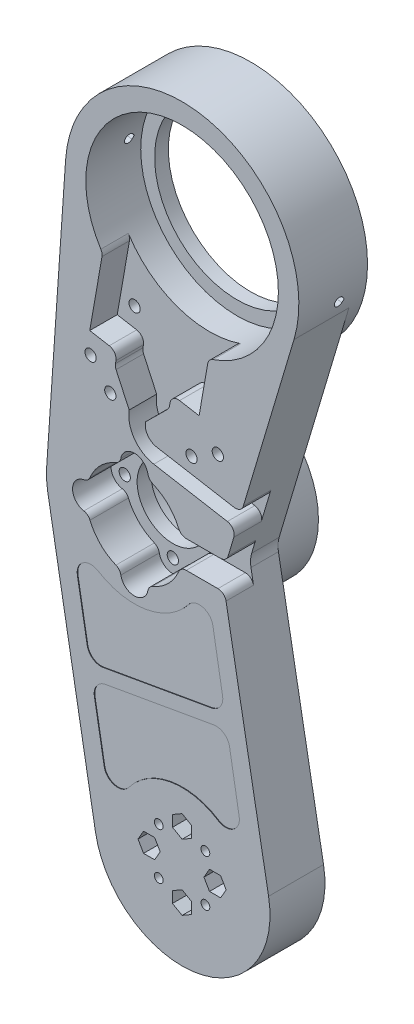
from build123d import *

# Parameters (mm, degrees)
MAIN_R                   = 32
MAIN_R_2                 = 25
MAIN_R_3                 = 16.25
MAIN_R_4                 = 2.05
MAIN_R_5                 = 35.05
BOSS_EXTRUDE10_DEPTH     = 20
BOSS_EXTRUDE11_START     = 6
MAIN_18_R                = 25
BOSS_EXTRUDE11_DEPTH     = 14
BOSS_EXTRUDE12_START     = 1
MAIN_19_R                = 25
MAIN_19_R_2              = 2.05
MAIN_19_R_3              = 13
BOSS_EXTRUDE12_DEPTH     = 5
BOSS_EXTRUDE13_START     = -15
MAIN_20_R                = 32
MAIN_20_R_2              = 25
BOSS_EXTRUDE13_DEPTH     = 15
BOSS_EXTRUDE14_START     = -5
MAIN_21_R                = 42.5
MAIN_21_R_2              = 35.05
MAIN_21_R_3              = 30
BOSS_EXTRUDE14_DEPTH     = 5
MAIN_24_R                = 16.25
CUT_EXTRUDE1_DEPTH       = 3.5
SKETCH1_R                = 2.05
SKETCH1_R_2              = 1.6
CUT_EXTRUDE2_DEPTH       = 7
CUT_EXTRUDE3_START       = -7
SKETCH1_4_R              = 1.6
CUT_EXTRUDE3_DEPTH       = 13
CUT_EXTRUDE4_START       = -10
CUT_EXTRUDE4_DEPTH       = 10
CUT_EXTRUDE5_START       = -10
SKETCH2_12_R             = 2.05
CUT_EXTRUDE5_DEPTH       = 7
CUT_EXTRUDE6_START       = -17
SKETCH2_13_R             = 1.6
CUT_EXTRUDE6_DEPTH       = 7
BOSS_EXTRUDE15_DEPTH     = 10
INTERSECT1_START         = 10
INTERSECT1_DEPTH         = 10
FILLET1_R                = 3
CUT_EXTRUDE8_DEPTH       = 10
FILLET3_R                = 3
FILLET4_R                = 3.25
CUT_EXTRUDE10_DEPTH      = 13
CUT_EXTRUDE11_REACH      = 248.187
SKETCH6_R                = 1.6
SKETCH6_3_R              = 1.6
CUT_EXTRUDE12_DEPTH      = 3.5
SKETCH4_R                = 2.05
CUT_EXTRUDE13_DEPTH      = 7
CUT_EXTRUDE14_START      = -7
SKETCH4_3_R              = 1.6
CUT_EXTRUDE14_DEPTH      = 13
FILLET5_R                = 10
CUT_EXTRUDE15_START      = -12.6
CUT_EXTRUDE15_DEPTH      = 12.6
CUT_EXTRUDE16_DEPTH      = 256.538758289
CUT_EXTRUDE16_DEPTH_BACK = 256.538758289
CUT_EXTRUDE17_START      = -0.2
CUT_EXTRUDE17_DEPTH      = 0.2


# Read off the part's stored shape, not the designer's step: Intersect1
with BuildPart() as part:
    # Main → Boss-Extrude10 (new body)
    # profile 1 of 6: a face of its own
    with BuildSketch(Plane(origin=(0, 0, 0), x_dir=(0, 1, 0), z_dir=(0, 0, 1))):
        with Locations((98.480775301, 17.364817767)):
            Circle(MAIN_R)
        with Locations(Location((98.480775301, 17.364817767, 0), (0, 0, 270))):
            Circle(MAIN_R_2, mode=Mode.SUBTRACT)
    # profile 2 of 6: a face of its own
    with BuildSketch(Plane(origin=(0, 0, 0), x_dir=(0, 1, 0), z_dir=(0, 0, 1))):
        with BuildLine():
            Line((92.924033616, 48.878665863), (-5.556741685, 31.513848096))
            ThreePointArc((-5.556741685, 31.513848096), (20.56920351, 24.51342218), (32, 0))
            ThreePointArc((32, 0), (24.566327125, -20.505988676), (5.719026775, -31.484801615))
            Line((5.719026775, -31.484801615), (98.480775301, -14.635182233))
            ThreePointArc((98.480775301, -14.635182233), (66.602544962, 14.575833999), (92.924033616, 48.878665863))
        make_face()
    # profile 3 of 6: a face of its own
    with BuildSketch(Plane(origin=(0, 0, 0), x_dir=(0, 1, 0), z_dir=(0, 0, 1))):
        Circle(MAIN_R)
        Circle(MAIN_R_3, mode=Mode.SUBTRACT)
    # profile 4 of 6: a face of its own
    with BuildSketch(Plane(origin=(0, 0, 0), x_dir=(0, 1, 0), z_dir=(0, 0, 1))):
        Circle(MAIN_R_3)
        with Locations(Location((0, 12, 0), (0, 0, 270))):
            Circle(MAIN_R_4, mode=Mode.SUBTRACT)
        with Locations(Location((-12, 0, 0), (0, 0, 270))):
            Circle(MAIN_R_4, mode=Mode.SUBTRACT)
        with Locations(Location((0, -12, 0), (0, 0, 270))):
            Circle(MAIN_R_4, mode=Mode.SUBTRACT)
        with Locations(Location((12, 0, 0), (0, 0, 270))):
            Circle(MAIN_R_4, mode=Mode.SUBTRACT)
    # profile 5 of 6: a face of its own
    with BuildSketch(Plane(origin=(0, 0, 0), x_dir=(0, 1, 0), z_dir=(0, 0, 1))):
        with BuildLine():
            Line((200.891680149, 42.399924481), (100.6754928, 49.289466787))
            ThreePointArc((100.6754928, 49.289466787), (121.871275082, 39.202503542), (130.480775301, 17.364817767))
            ThreePointArc((130.480775301, 17.364817767), (121.108192299, -5.262599231), (98.480775301, -14.635182233))
            Line((98.480775301, -14.635182233), (185.812766687, -40.722055245))
            ThreePointArc((185.812766687, -40.722055245), (156.159327252, 7.58598834), (200.891680149, 42.399924481))
        make_face()
    # profile 6 of 6: a face of its own
    with BuildSketch(Plane(origin=(0, 0, 0), x_dir=(0, 1, 0), z_dir=(0, 0, 1))):
        with BuildLine():
            ThreePointArc((240.476820971, 0), (229.042328492, 29.00317642), (200.891680149, 42.399924481))
            ThreePointArc((200.891680149, 42.399924481), (156.159327252, 7.58598834), (185.812766687, -40.722055245))
            ThreePointArc((185.812766687, -40.722055245), (223.366559971, -34.082417073), (240.476820971, 0))
        make_face()
        with Locations(Location((197.976820971, 0, 0), (0, 0, 270))):
            Circle(MAIN_R_5, mode=Mode.SUBTRACT)
    extrude(amount=BOSS_EXTRUDE10_DEPTH)

    # Main<18> → Boss-Extrude11 (add)
    with BuildSketch(Plane(origin=(0, 0, 0), x_dir=(0, 1, 0), z_dir=(0, 0, 1)).offset(BOSS_EXTRUDE11_START)):
        with Locations(Location((98.480775301, 17.364817767, 0), (0, 0, 270))):
            Circle(MAIN_18_R)
        with BuildLine():
            ThreePointArc((103.429491894, 34.150532052), (110.855143972, 29.739186437), (115.266489587, 22.31353436))
            ThreePointArc((115.266489587, 22.31353436), (120.980775301, 17.364817767), (115.266489587, 12.416101174))
            ThreePointArc((115.266489587, 12.416101174), (110.855143972, 4.990449096), (103.429491894, 0.579103481))
            ThreePointArc((103.429491894, 0.579103481), (98.480775301, -5.135182233), (93.532058708, 0.579103481))
            ThreePointArc((93.532058708, 0.579103481), (86.10640663, 4.990449096), (81.695061016, 12.416101174))
            ThreePointArc((81.695061016, 12.416101174), (75.980775301, 17.364817767), (81.695061016, 22.31353436))
            ThreePointArc((81.695061016, 22.31353436), (86.10640663, 29.739186437), (93.532058708, 34.150532052))
            ThreePointArc((93.532058708, 34.150532052), (98.480775301, 39.864817767), (103.429491894, 34.150532052))
        make_face(mode=Mode.SUBTRACT)
    extrude(amount=BOSS_EXTRUDE11_DEPTH)

    # Main<19> → Boss-Extrude12 (add)
    with BuildSketch(Plane(origin=(0, 0, 0), x_dir=(0, 1, 0), z_dir=(0, 0, 1)).offset(BOSS_EXTRUDE12_START)):
        with Locations(Location((98.480775301, 17.364817767, 0), (0, 0, 270))):
            Circle(MAIN_19_R)
        with Locations(Location((98.480775301, -0.135182233, 0), (0, 0, 270))):
            Circle(MAIN_19_R_2, mode=Mode.SUBTRACT)
        with Locations(Location((80.980775301, 17.364817767, 0), (0, 0, 270))):
            Circle(MAIN_19_R_2, mode=Mode.SUBTRACT)
        with Locations(Location((98.480775301, 17.364817767, 0), (0, 0, 270))):
            Circle(MAIN_19_R_3, mode=Mode.SUBTRACT)
        with Locations(Location((98.480775301, 34.864817767, 0), (0, 0, 270))):
            Circle(MAIN_19_R_2, mode=Mode.SUBTRACT)
        with Locations(Location((115.980775301, 17.364817767, 0), (0, 0, 270))):
            Circle(MAIN_19_R_2, mode=Mode.SUBTRACT)
    extrude(amount=BOSS_EXTRUDE12_DEPTH)

    # Main<20> → Boss-Extrude13 (add)
    with BuildSketch(Plane(origin=(0, 0, 0), x_dir=(0, 1, 0), z_dir=(0, 0, 1)).offset(BOSS_EXTRUDE13_START)):
        with Locations(Location((98.480775301, 17.364817767, 0), (0, 0, 270))):
            Circle(MAIN_20_R)
        with Locations(Location((98.480775301, 17.364817767, 0), (0, 0, 270))):
            Circle(MAIN_20_R_2, mode=Mode.SUBTRACT)
    extrude(amount=BOSS_EXTRUDE13_DEPTH)

    # Main<21> → Boss-Extrude14 (add)
    # profile 1 of 2: a face of its own
    with BuildSketch(Plane(origin=(0, 0, 0), x_dir=(0, 1, 0), z_dir=(0, 0, 1)).offset(BOSS_EXTRUDE14_START)):
        with Locations(Location((197.976820971, 0, 0), (0, 0, 86.067286144))):
            Circle(MAIN_21_R)
        with Locations(Location((197.976820971, 0, 0), (0, 0, 270))):
            Circle(MAIN_21_R_2, mode=Mode.SUBTRACT)
    # profile 2 of 2: a face of its own
    with BuildSketch(Plane(origin=(0, 0, 0), x_dir=(0, 1, 0), z_dir=(0, 0, 1)).offset(BOSS_EXTRUDE14_START)):
        with Locations(Location((197.976820971, 0, 0), (0, 0, 270))):
            Circle(MAIN_21_R_2)
        with Locations(Location((197.976820971, 0, 0), (0, 0, 270))):
            Circle(MAIN_21_R_3, mode=Mode.SUBTRACT)
    extrude(amount=BOSS_EXTRUDE14_DEPTH)

    # Main<24> → Cut-Extrude1 (cut)
    with BuildSketch(Plane(origin=(0, 0, 0), x_dir=(0, 1, 0), z_dir=(0, 0, 1))):
        with Locations(Location((0, 0, 0), (0, 0, 270))):
            Circle(MAIN_24_R)
    extrude(amount=CUT_EXTRUDE1_DEPTH, mode=Mode.SUBTRACT)

    # Sketch1 → Cut-Extrude2 (cut)
    # profile 1 of 4: a face of its own
    with BuildSketch(Plane.XY.offset(20)):
        with Locations((-33.29387447, 143.895697436)):
            Circle(SKETCH1_R)
        with Locations((-33.29387447, 143.895697436)):
            Circle(SKETCH1_R_2, mode=Mode.SUBTRACT)
    # profile 2 of 4: a face of its own
    with BuildSketch(Plane.XY.offset(20)):
        with Locations((-33.29387447, 143.895697436)):
            Circle(SKETCH1_R_2)
    # profile 3 of 4: a face of its own
    with BuildSketch(Plane.XY.offset(20)):
        with Locations((13.006265594, 135.815039664)):
            Circle(SKETCH1_R)
        with Locations((13.006265594, 135.815039664)):
            Circle(SKETCH1_R_2, mode=Mode.SUBTRACT)
    # profile 4 of 4: a face of its own
    with BuildSketch(Plane.XY.offset(20)):
        with Locations((13.006265594, 135.815039664)):
            Circle(SKETCH1_R_2)
    extrude(amount=-CUT_EXTRUDE2_DEPTH, mode=Mode.SUBTRACT)

    # Sketch1<4> → Cut-Extrude3 (cut)
    with BuildSketch(Plane.XY.offset(20).offset(CUT_EXTRUDE3_START)):
        with Locations((-33.29387447, 143.895697436)):
            Circle(SKETCH1_4_R)
        with Locations((13.006265594, 135.815039664)):
            Circle(SKETCH1_4_R)
    extrude(amount=-CUT_EXTRUDE3_DEPTH, mode=Mode.SUBTRACT)

    # Sketch2 → Cut-Extrude4 (cut)
    with BuildSketch(Plane.XY.offset(20).offset(CUT_EXTRUDE4_START)):
        with BuildLine():
            Line((-32.418215797, 158.293450187), (-28.942657764, 178.207525041))
            ThreePointArc((-28.942657764, 178.207525041), (-11.90330288, 165.009960633), (9.636870325, 164.277663262))
            Line((9.636870325, 164.277663262), (7.380202471, 151.34752308))
            Line((7.380202471, 151.34752308), (6.193893138, 144.550268475))
            Line((6.193893138, 144.550268475), (-3.854222365, 146.303943141))
            Line((-3.854222365, 146.303943141), (-23.556409627, 149.742520916))
            Line((-23.556409627, 149.742520916), (-33.60452513, 151.496195582))
            Line((-33.60452513, 151.496195582), (-32.418215797, 158.293450187))
        make_face()
    extrude(amount=CUT_EXTRUDE4_DEPTH, mode=Mode.SUBTRACT)

    # Sketch2<12> → Cut-Extrude5 (cut)
    with BuildSketch(Plane.XY.offset(20).offset(CUT_EXTRUDE5_START)):
        with Locations((-27.295647109, 157.399419965)):
            Circle(SKETCH2_12_R)
        with Locations((2.257633783, 152.241553302)):
            Circle(SKETCH2_12_R)
    extrude(amount=-CUT_EXTRUDE5_DEPTH, mode=Mode.SUBTRACT)

    # Sketch2<13> → Cut-Extrude6 (cut)
    with BuildSketch(Plane.XY.offset(20).offset(CUT_EXTRUDE6_START)):
        with Locations((-27.295647109, 157.399419965)):
            Circle(SKETCH2_13_R)
        with Locations((2.257633783, 152.241553302)):
            Circle(SKETCH2_13_R)
    extrude(amount=-CUT_EXTRUDE6_DEPTH, mode=Mode.SUBTRACT)


with BuildPart() as body_2:
    # Sketch3 → Boss-Extrude15 (new body)
    with BuildSketch(Plane.XY.offset(20)):
        with BuildLine():
            Line((-3.854222365, 146.303943141), (-23.556409627, 149.742520916))
            Line((-23.556409627, 149.742520916), (-24.416054071, 144.816974101))
            Line((-24.416054071, 144.816974101), (-19.262897785, 133.623516702))
            ThreePointArc((-19.262897785, 133.623516702), (-19.251459791, 133.69298479), (-19.239577417, 133.762378249))
            ThreePointArc((-19.239577417, 133.762378249), (-15.839829323, 136.213490782), (-13.307502157, 132.873796353))
            Line((-13.307502157, 132.873796353), (-4.713866809, 141.378396325))
            Line((-4.713866809, 141.378396325), (-3.854222365, 146.303943141))
        make_face()
        with BuildLine():
            ThreePointArc((-19.239577417, 133.762378249), (-19.251459791, 133.69298479), (-19.262897785, 133.623516702))
            ThreePointArc((-19.262897785, 133.623516702), (-17.362353479, 125.488630075), (-10.2945922, 121.034957479))
            ThreePointArc((-10.2945922, 121.034957479), (-6.823477444, 123.474498901), (-9.263018867, 126.945613657))
            ThreePointArc((-9.263018867, 126.945613657), (-12.494122393, 128.996133334), (-13.328921238, 132.730804916))
            ThreePointArc((-13.328921238, 132.730804916), (-13.317350128, 132.802171578), (-13.307502157, 132.873796353))
            ThreePointArc((-13.307502157, 132.873796353), (-15.839829323, 136.213490782), (-19.239577417, 133.762378249))
        make_face()
        with BuildLine():
            ThreePointArc((-9.263018867, 126.945613657), (-6.823477444, 123.474498901), (-10.2945922, 121.034957479))
            Line((-10.2945922, 121.034957479), (19.80323368, 115.782052621))
            Line((19.80323368, 115.782052621), (21.532431998, 121.570953903))
            Line((21.532431998, 121.570953903), (-9.263018867, 126.945613657))
        make_face()
    extrude(amount=-BOSS_EXTRUDE15_DEPTH)


with BuildPart() as intersect1_tool:
    # Intersect1 outline → Intersect1 (new body)
    with BuildSketch(Plane.XY.offset(INTERSECT1_START)):
        with BuildLine():
            Line((-10.2945922, 121.034957479), (19.80323368, 115.782052621))
            Line((19.80323368, 115.782052621), (21.532431998, 121.570953903))
            Line((21.532431998, 121.570953903), (-9.263018867, 126.945613657))
            ThreePointArc((-9.263018867, 126.945613657), (-12.494122393, 128.996133334), (-13.328921238, 132.730804916))
            ThreePointArc((-13.328921238, 132.730804916), (-13.317350128, 132.802171578), (-13.307502157, 132.873796353))
            Line((-13.307502157, 132.873796353), (-4.713866809, 141.378396325))
            Line((-4.713866809, 141.378396325), (-3.854222365, 146.303943141))
            Line((-3.854222365, 146.303943141), (-23.556409627, 149.742520916))
            Line((-23.556409627, 149.742520916), (-24.416054071, 144.816974101))
            Line((-24.416054071, 144.816974101), (-19.262897785, 133.623516702))
            ThreePointArc((-19.262897785, 133.623516702), (-17.362353479, 125.488630075), (-10.2945922, 121.034957479))
        make_face()
    extrude(amount=INTERSECT1_DEPTH)


with BuildPart() as part_1:
    add(part.part)

    # Intersect1: cut by intersect1_tool
    add(intersect1_tool.part, mode=Mode.SUBTRACT)

    # Fillet1
    fillet1_edges = [part_1.edges().sort_by_distance(p)[0] for p in [
        (-28.942657764, 178.207525041, 15),
        (9.636870325, 164.277663262, 15),
        (-3.854222365, 146.303943141, 15),
        (19.80323368, 115.782052621, 15),
        (21.532431998, 121.570953903, 15),
        (-23.556409627, 149.742520916, 15),
        (-24.416054071, 144.816974101, 15),
        (-4.713866809, 141.378396325, 15),
    ]]
    fillet(fillet1_edges, radius=FILLET1_R)

    # Sketch5 → Cut-Extrude8 (cut)
    with BuildSketch(Plane.XY.offset(20)):
        Polygon((16.128728447, 103.480775301), (14.635182233, 98.480775301), (15.543402467, 93.480775301), (-1.864817767, 93.480775301), (-1.864817767, 103.480775301), align=None)
    extrude(amount=-CUT_EXTRUDE8_DEPTH, mode=Mode.SUBTRACT)

    # Fillet3
    # the kernel refuses this fillet: 3 mm, written as the material it takes off along each edge
    with BuildSketch(Plane(origin=(-22.31353436, 115.266489587, 6), x_dir=(0.018092404043592625, 0.999836319062237, 0), z_dir=(0, 0, 1)), Plane(origin=(-12.416101174, 81.695061016, 6), x_dir=(-0.018092404043601622, -0.9998363190622368, 0), z_dir=(0, 0, 1)), Plane(origin=(-34.150532052, 93.532058708, 6), x_dir=(-0.9998363190622366, 0.018092404043610618, 0), z_dir=(0, 0, 1))) as fillet3_piece_1:
        with BuildLine():
            CenterArc((2.089627747, 2.960990062), FILLET3_R, 203.616579082, 57.133535261)
            ThreePointArc((-0.659112793, 1.75914754), (-0.305934486, 0.888424365), (0, 0))
            ThreePointArc((0, 0), (0.803702979, 0.065016563), (1.607405959, 0))
        make_face()
    extrude(amount=18.696427991, mode=Mode.SUBTRACT)
    with BuildSketch(Plane(origin=(-12.416101174, 115.266489587, 6), x_dir=(0.9426230632930053, -0.33385889316912154, 0), z_dir=(0, 0, 1)), Plane(origin=(-22.31353436, 81.695061016, 6), x_dir=(-0.9426230632930039, 0.3338588931691254, 0), z_dir=(0, 0, 1)), Plane(origin=(-34.150532052, 103.429491894, 6), x_dir=(0.33385889316913037, 0.9426230632930022, 0), z_dir=(0, 0, 1))) as fillet3_piece_2:
        with BuildLine():
            CenterArc((2.039591585, 2.995675622), FILLET3_R, 209.789723377, 57.133535261)
            ThreePointArc((-0.563972147, 1.505220693), (-0.221102713, 0.775421964), (0, 0))
            ThreePointArc((0, 0), (0.939285598, 0.025225536), (1.878571196, 0))
        make_face()
    extrude(amount=18.696427991, mode=Mode.SUBTRACT)
    with BuildSketch(Plane(origin=(-0.594307935, 93.480775301, 25.260190642), x_dir=(-0.33850165532610577, -0.9409657960529099, 0), z_dir=(0, 0, -1))) as fillet3_piece_3:
        with BuildLine():
            CenterArc((2.110664092, -2.995368756), FILLET3_R, 93.184063487, 67.030323428)
            Line((-0.712233296, -1.97986379), (0, 0))
            ThreePointArc((0, 0), (0.972016358, -0.02701559), (1.944032717, 0))
        make_face()
    extrude(amount=15.260190642, mode=Mode.SUBTRACT)
    with BuildSketch(Plane(origin=(-0.594307935, 103.480775301, 25.260190642), x_dir=(1, 0, 0), z_dir=(0, 0, -1))) as fillet3_piece_4:
        with BuildLine():
            CenterArc((2.104076257, -3), FILLET3_R, 90, 67.030323428)
            ThreePointArc((-0.658058293, -1.829268293), (-0.3036084, -0.923778968), (0, 0))
            Line((0, 0), (2.104076257, 0))
        make_face()
    extrude(amount=15.260190642, mode=Mode.SUBTRACT)
    with BuildSketch(Plane(origin=(15.543402467, 93.480775301, 26.260395145), x_dir=(-1, 0, 0), z_dir=(0, 0, -1))) as fillet3_piece_5:
        with BuildLine():
            CenterArc((FILLET3_R * 0.834719352725, -FILLET3_R), FILLET3_R, 90, 79.704811763)
            Line((-FILLET3_R * 0.149180697748, -FILLET3_R * 0.821280413277), (0, 0))
            Line((0, 0), (FILLET3_R * 0.834719352725, 0))
        make_face()
    extrude(amount=16.260395145, mode=Mode.SUBTRACT)
    with BuildSketch(Plane(origin=(16.128728447, 103.480775301, 25.587134331), x_dir=(-1, 0, 0), z_dir=(0, 0, -1))) as fillet3_piece_6:
        with BuildLine():
            CenterArc((FILLET3_R * 0.744951244073, FILLET3_R), FILLET3_R, 196.63137158, 73.36862842)
            Line((-FILLET3_R * 0.213214761691, FILLET3_R * 0.713786958023), (0, 0))
            Line((0, 0), (FILLET3_R * 0.744951244073, 0))
        make_face()
    extrude(amount=15.587134331, mode=Mode.SUBTRACT)

    # Fillet4
    # the kernel refuses this fillet: 3.25 mm, written as the material it takes off along each edge
    with BuildSketch(Plane(origin=(-0.579103481, 93.532058708, 6), x_dir=(-0.3369248544443787, -0.9415315408724416, 0), z_dir=(0, 0, 1))) as fillet4_piece_1:
        with BuildLine():
            CenterArc((2.177302746, 3.244730367), FILLET4_R, 210.922973776, 55.813817694)
            ThreePointArc((-0.610738754, 1.574603248), (-0.238404786, 0.813275069), (0, 0))
            ThreePointArc((0, 0), (0.996151583, 0.028374946), (1.992303167, 0))
        make_face()
    extrude(amount=8.980757916, mode=Mode.SUBTRACT)
    with BuildSketch(Plane(origin=(-0.579103481, 103.429491894, 6), x_dir=(-0.3369248544443786, 0.9415315408724416, 0), z_dir=(0, 0, 1))) as fillet4_piece_2:
        with BuildLine():
            CenterArc((2.177302746, -3.244730367), FILLET4_R, 93.26320853, 55.813817694)
            ThreePointArc((-0.610738754, -1.574603248), (-0.238404786, -0.813275069), (0, 0))
            ThreePointArc((0, 0), (0.996151583, -0.028374946), (1.992303167, 0))
        make_face()
    extrude(amount=8.980757916, mode=Mode.SUBTRACT)

    # Sketch7 → Cut-Extrude10 (cut)
    with BuildSketch(Plane.XY.offset(20)):
        Polygon((0, 7.958548116), (3.5, 9.979274058), (3.5, 14.020725942), (0, 16.041451884), (-3.5, 14.020725942), (-3.5, 9.979274058), align=None)
        Polygon((-7.958548116, 0), (-9.979274058, 3.5), (-14.020725942, 3.5), (-16.041451884, 0), (-14.020725942, -3.5), (-9.979274058, -3.5), align=None)
        Polygon((7.958548116, 0), (9.979274058, -3.5), (14.020725942, -3.5), (16.041451884, 0), (14.020725942, 3.5), (9.979274058, 3.5), align=None)
        Polygon((0, -7.958548116), (-3.5, -9.979274058), (-3.5, -14.020725942), (0, -16.041451884), (3.5, -14.020725942), (3.5, -9.979274058), align=None)
    extrude(amount=-CUT_EXTRUDE10_DEPTH, mode=Mode.SUBTRACT)

    # Sketch6 → Cut-Extrude11 (cut, up to next)
    with BuildSketch(Plane(origin=(0, 0, 3.5), x_dir=(1, 0, 0), z_dir=(0, 0, -1)), mode=Mode.PRIVATE) as cut_extrude11_sk1:
        with Locations(Location((8.485281374, -8.485281374, 0), (0, 0, 180))):
            Circle(SKETCH6_R)
    cut_extrude11_tool1 = extrude(cut_extrude11_sk1.sketch, amount=-CUT_EXTRUDE11_REACH, mode=Mode.PRIVATE) & part_1.part
    # Sketch6 → Cut-Extrude11 (cut, up to next)
    with BuildSketch(Plane(origin=(0, 0, 3.5), x_dir=(1, 0, 0), z_dir=(0, 0, -1)), mode=Mode.PRIVATE) as cut_extrude11_sk2:
        with Locations(Location((-8.485281374, -8.485281374, 0), (0, 0, 180))):
            Circle(SKETCH6_R)
    cut_extrude11_tool2 = extrude(cut_extrude11_sk2.sketch, amount=-CUT_EXTRUDE11_REACH, mode=Mode.PRIVATE) & part_1.part
    # Sketch6 → Cut-Extrude11 (cut, up to next)
    with BuildSketch(Plane(origin=(0, 0, 3.5), x_dir=(1, 0, 0), z_dir=(0, 0, -1)), mode=Mode.PRIVATE) as cut_extrude11_sk3:
        with Locations(Location((-8.485281374, 8.485281374, 0), (0, 0, 180))):
            Circle(SKETCH6_R)
    cut_extrude11_tool3 = extrude(cut_extrude11_sk3.sketch, amount=-CUT_EXTRUDE11_REACH, mode=Mode.PRIVATE) & part_1.part
    # Sketch6 → Cut-Extrude11 (cut, up to next)
    with BuildSketch(Plane(origin=(0, 0, 3.5), x_dir=(1, 0, 0), z_dir=(0, 0, -1)), mode=Mode.PRIVATE) as cut_extrude11_sk4:
        with Locations(Location((8.485281374, 8.485281374, 0), (0, 0, 180))):
            Circle(SKETCH6_R)
    cut_extrude11_tool4 = extrude(cut_extrude11_sk4.sketch, amount=-CUT_EXTRUDE11_REACH, mode=Mode.PRIVATE) & part_1.part
    add(cut_extrude11_tool1.solids().sort_by_distance((8.485281, 8.485281, 3.5))[0], mode=Mode.SUBTRACT)
    add(cut_extrude11_tool2.solids().sort_by_distance((-8.485281, 8.485281, 3.5))[0], mode=Mode.SUBTRACT)
    add(cut_extrude11_tool3.solids().sort_by_distance((-8.485281, -8.485281, 3.5))[0], mode=Mode.SUBTRACT)
    add(cut_extrude11_tool4.solids().sort_by_distance((8.485281, -8.485281, 3.5))[0], mode=Mode.SUBTRACT)

    # Sketch6<3> → Cut-Extrude12 (cut)
    # profile 1 of 4: a face of its own
    with BuildSketch(Plane(origin=(0, 0, 3.5), x_dir=(1, 0, 0), z_dir=(0, 0, -1))):
        Polygon((12.374368671, -8.485281374), (8.485281374, -12.374368671), (4.596194078, -8.485281374), (8.485281374, -4.596194078), align=None)
        with Locations(Location((8.485281374, -8.485281374, 0), (0, 0, 180))):
            Circle(SKETCH6_3_R, mode=Mode.SUBTRACT)
    # profile 2 of 4: a face of its own
    with BuildSketch(Plane(origin=(0, 0, 3.5), x_dir=(1, 0, 0), z_dir=(0, 0, -1))):
        Polygon((12.374368671, 8.485281374), (8.485281374, 4.596194078), (4.596194078, 8.485281374), (8.485281374, 12.374368671), align=None)
        with Locations(Location((8.485281374, 8.485281374, 0), (0, 0, 180))):
            Circle(SKETCH6_3_R, mode=Mode.SUBTRACT)
    # profile 3 of 4: a face of its own
    with BuildSketch(Plane(origin=(0, 0, 3.5), x_dir=(1, 0, 0), z_dir=(0, 0, -1))):
        Polygon((-8.485281374, -12.374368671), (-12.374368671, -8.485281374), (-8.485281374, -4.596194078), (-4.596194078, -8.485281374), align=None)
        with Locations(Location((-8.485281374, -8.485281374, 0), (0, 0, 180))):
            Circle(SKETCH6_3_R, mode=Mode.SUBTRACT)
    # profile 4 of 4: a face of its own
    with BuildSketch(Plane(origin=(0, 0, 3.5), x_dir=(1, 0, 0), z_dir=(0, 0, -1))):
        Polygon((-12.374368671, 8.485281374), (-8.485281374, 12.374368671), (-4.596194078, 8.485281374), (-8.485281374, 4.596194078), align=None)
        with Locations(Location((-8.485281374, 8.485281374, 0), (0, 0, 180))):
            Circle(SKETCH6_3_R, mode=Mode.SUBTRACT)
    extrude(amount=-CUT_EXTRUDE12_DEPTH, mode=Mode.SUBTRACT)

    # Sketch4 → Cut-Extrude13 (cut)
    with BuildSketch(Plane.XY.offset(20)):
        with Locations((-26.123947105, 135.53853634)):
            Circle(SKETCH4_R)
        with Locations((3.429333787, 130.380669677)):
            Circle(SKETCH4_R)
    extrude(amount=-CUT_EXTRUDE13_DEPTH, mode=Mode.SUBTRACT)

    # Sketch4<3> → Cut-Extrude14 (cut)
    with BuildSketch(Plane.XY.offset(20).offset(CUT_EXTRUDE14_START)):
        with Locations((-26.123947105, 135.53853634)):
            Circle(SKETCH4_3_R)
        with Locations((3.429333787, 130.380669677)):
            Circle(SKETCH4_3_R)
    extrude(amount=-CUT_EXTRUDE14_DEPTH, mode=Mode.SUBTRACT)

    # Fillet5
    # the kernel refuses this fillet: 10 mm, written as the material it adds along each edge
    with BuildSketch(Plane(origin=(14.635182233, 98.480775301, 0), x_dir=(0.2862130419774193, 0.9581660057641536, 0), z_dir=(0, 0, 1))) as fillet5_piece_1:
        with BuildLine():
            CenterArc((FILLET5_R * 0.239401037471, -FILLET5_R), FILLET5_R, 90, 26.926559817)
            Line((-FILLET5_R * 0.213447021539, -FILLET5_R * 0.108412295144), (0, 0))
            Line((0, 0), (FILLET5_R * 0.239401037471, 0))
        make_face()
    extrude(amount=10)

    # Sketch11 → Cut-Extrude15 (cut)
    with BuildSketch(Plane(origin=(0, 0, -5), x_dir=(1, 0, 0), z_dir=(0, 0, -1)).offset(CUT_EXTRUDE15_START)):
        Polygon((36.935562019, -188.586706045), (37.932749574, -194.30034035), (39.9029683, -193.956482573), (38.905780745, -188.242848267), align=None)
        Polygon((-39.9029683, -201.997159369), (-38.905780745, -207.710793675), (-36.935562019, -207.366935898), (-37.932749574, -201.653301592), align=None)
    extrude(amount=CUT_EXTRUDE15_DEPTH, mode=Mode.SUBTRACT)

    # Sketch12 → Cut-Extrude16 (cut, two sides: drawn at the far end of the back side and taken through both)
    with BuildSketch(Plane(origin=(-70.965244101, 12.385402086, 0), x_dir=(-0.17192888877913734, -0.9851093630674571, 0), z_dir=(-0.9851093630674571, 0.17192888877913734, 0)).offset(-CUT_EXTRUDE16_DEPTH_BACK)):
        with BuildLine():
            Line((-195.028820009, 2.85), (-194.068820009, 3.57))
            ThreePointArc((-194.068820009, 3.57), (-195.028820009, 6.45), (-195.988820009, 3.57))
            Line((-195.988820009, 3.57), (-195.028820009, 2.85))
        make_face()
    extrude(amount=CUT_EXTRUDE16_DEPTH + CUT_EXTRUDE16_DEPTH_BACK, mode=Mode.SUBTRACT)

    # Sketch13 → Cut-Extrude17 (cut)
    with BuildSketch(Plane.XY.offset(20).offset(CUT_EXTRUDE17_START)):
        with BuildLine():
            Line((11.216121075, 80.878789543), (14.73896886, 60.471957704))
            ThreePointArc((14.73896886, 60.471957704), (13.902457546, 56.746161509), (10.680088309, 54.697346004))
            Line((10.680088309, 54.697346004), (-28.727908052, 47.74865299))
            ThreePointArc((-28.727908052, 47.74865299), (-32.464031122, 48.576931534), (-34.520187706, 51.804450867))
            Line((-34.520187706, 51.804450867), (-38.102120298, 72.118600055))
            ThreePointArc((-38.102120298, 72.118600055), (-35.980903807, 77.127394927), (-30.542537572, 77.235830003))
            ThreePointArc((-30.542537572, 77.235830003), (-12.973869601, 73.86940447), (2.346696735, 83.103643057))
            ThreePointArc((2.346696735, 83.103643057), (7.505535775, 84.877962975), (11.216121075, 80.878789543))
        make_face()
        with BuildLine():
            Line((-27.859667164, 42.824614225), (11.495341753, 49.763964123))
            ThreePointArc((11.495341753, 49.763964123), (15.238805902, 48.930535484), (17.290704081, 45.690498293))
            Line((17.290704081, 45.690498293), (20.782122955, 25.465724987))
            ThreePointArc((20.782122955, 25.465724987), (18.614987263, 20.445922067), (13.147471823, 20.41166743))
            ThreePointArc((13.147471823, 20.41166743), (-4.278252374, 23.89955521), (-19.411897142, 14.583224333))
            ThreePointArc((-19.411897142, 14.583224333), (-24.573146756, 12.723720079), (-28.333532449, 16.718185384))
            Line((-28.333532449, 16.718185384), (-31.915465041, 37.032334572))
            ThreePointArc((-31.915465041, 37.032334572), (-31.087186497, 40.768457642), (-27.859667164, 42.824614225))
        make_face()
    extrude(amount=CUT_EXTRUDE17_DEPTH, mode=Mode.SUBTRACT)


with BuildPart() as body_2_1:
    add(body_2.part)

    # Intersect1: cut by intersect1_tool
    add(intersect1_tool.part, mode=Mode.SUBTRACT)


solid = part_1.part
